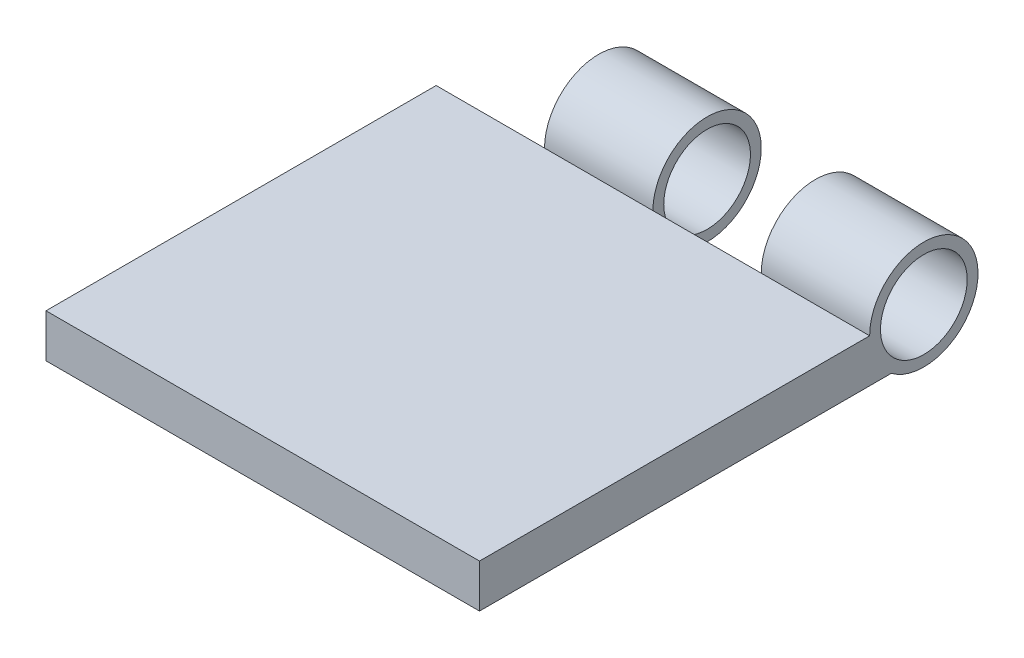
from build123d import *

# Parameters (mm, degrees)
SKETCH2_W           = 20
SKETCH2_H           = 18
BOSS_EXTRUDE2_DEPTH = 2
BOSS_EXTRUDE3_DEPTH = 5
SKETCH4_R           = 2
CUT_EXTRUDE1_DEPTH  = 25.824383175


with BuildPart() as part:
    # Sketch2 → Boss-Extrude2 (new body)
    with BuildSketch(Plane(origin=(0, 0, 0), x_dir=(1, 0, 0), z_dir=(0, 1, 0))):
        Rectangle(SKETCH2_W, SKETCH2_H)
    extrude(amount=BOSS_EXTRUDE2_DEPTH)

    # Sketch3 → Boss-Extrude3 (add)
    with BuildSketch(Plane(origin=(10, 0, 0), x_dir=(0, 0, -1), z_dir=(1, 0, 0))):
        with BuildLine():
            Line((9, 2), (9, 0))
            Line((9, 0), (10, 0))
            ThreePointArc((10, 0), (13.736067977, 3.118033989), (9, 2))
        make_face()
    boss_extrude3 = extrude(amount=-BOSS_EXTRUDE3_DEPTH)

    # Mirror1: Boss-Extrude3 across plane
    add(boss_extrude3.mirror(Plane.ZY.offset(-2.5)))

    # Sketch4 → Cut-Extrude1 (cut, through all)
    with BuildSketch(Plane(origin=(10, 0, 0), x_dir=(0, 0, -1), z_dir=(1, 0, 0))):
        with Locations((11.5, 2)):
            Circle(SKETCH4_R)
    extrude(amount=-CUT_EXTRUDE1_DEPTH, mode=Mode.SUBTRACT)


solid = part.part
